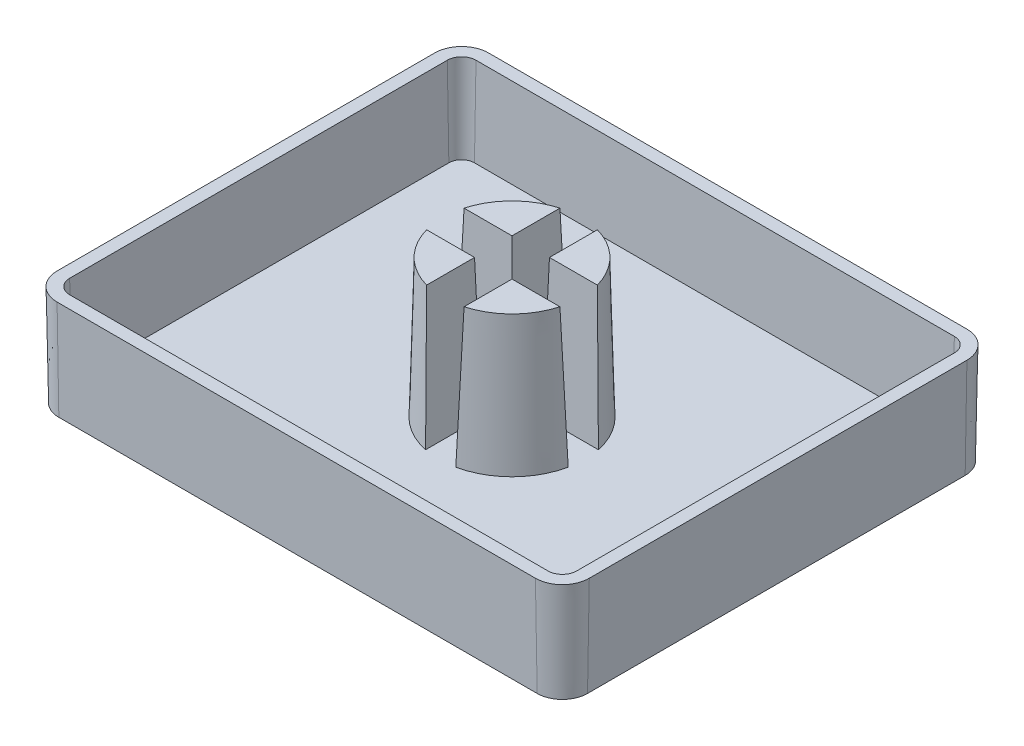
from build123d import *

# Parameters (mm, degrees)
BOSS_EXTRUDE1_DEPTH           = 4
BOSS_EXTRUDE1_DRAFT           = -1
SHELL1_T                      = -0.5
BOSS_EXTRUDE2_DEPTH           = 5.5
BOSS_EXTRUDE2_DRAFT           = 1.5
BOSS_EXTRUDE2_PROFILE_2_DEPTH = 5.5
BOSS_EXTRUDE2_PROFILE_2_DRAFT = 1.5
BOSS_EXTRUDE2_PROFILE_3_DEPTH = 5.5
BOSS_EXTRUDE2_PROFILE_3_DRAFT = 1.5
BOSS_EXTRUDE2_PROFILE_4_DEPTH = 5.5
BOSS_EXTRUDE2_PROFILE_4_DRAFT = 1.5


with BuildPart() as part:
    # Sketch1 → Boss-Extrude1 (with draft: the straight prism first)
    with BuildSketch(Plane(origin=(0, 0, 0), x_dir=(1, 0, 0), z_dir=(0, 1, 0))):
        with BuildLine():
            Line((-9.5, -8.5), (9.5, -8.5))
            ThreePointArc((9.5, -8.5), (10.207106781, -8.207106781), (10.5, -7.5))
            Line((10.5, -7.5), (10.5, 7.5))
            ThreePointArc((10.5, 7.5), (10.207106781, 8.207106781), (9.5, 8.5))
            Line((9.5, 8.5), (-9.5, 8.5))
            ThreePointArc((-9.5, 8.5), (-10.207106781, 8.207106781), (-10.5, 7.5))
            Line((-10.5, 7.5), (-10.5, -7.5))
            ThreePointArc((-10.5, -7.5), (-10.207106781, -8.207106781), (-9.5, -8.5))
        make_face()
    extrude(amount=BOSS_EXTRUDE1_DEPTH)
    # Boss-Extrude1: the draft: its side faces are tilted about the plane it starts from
    boss_extrude1_sides = [part.faces().sort_by_distance(p)[0] for p in [
        (0, 2, 8.5),
        (10.207106781, 2, 8.207106781),
        (10.5, 2, 0),
        (10.207106781, 2, -8.207106781),
        (0, 2, -8.5),
        (-10.207106781, 2, -8.207106781),
        (-10.5, 2, 0),
        (-10.207106781, 2, 8.207106781),
    ]]
    draft(boss_extrude1_sides, Plane(origin=(0, 0, 0), x_dir=(1, 0, 0), z_dir=(0, 1, 0)), BOSS_EXTRUDE1_DRAFT)

    # Shell1
    shell1_openings = [part.faces().sort_by_distance(p)[0] for p in [
        (0, 4, 0),
    ]]
    offset(amount=SHELL1_T, openings=shell1_openings, kind=Kind.INTERSECTION)


with BuildPart() as boss_extrude2_tool:
    # Sketch2 → Boss-Extrude2 (with draft: the straight prism first)
    with BuildSketch(Plane(origin=(0, 0.5, 0), x_dir=(1, 0, 0), z_dir=(0, 1, 0))):
        with BuildLine():
            ThreePointArc((-0.6, 2.831929782), (-2.046927733, 2.046927733), (-2.831929782, 0.6))
            Line((-2.831929782, 0.6), (-0.6, 0.6))
            Line((-0.6, 0.6), (-0.6, 2.831929782))
        make_face()
    extrude(amount=BOSS_EXTRUDE2_DEPTH)
    # Boss-Extrude2: the draft: its side faces are tilted about the plane it starts from
    boss_extrude2_sides = [boss_extrude2_tool.faces().sort_by_distance(p)[0] for p in [
        (-2.046927733, 3.25, -2.046927733),
        (-1.715964891, 3.25, -0.6),
        (-0.6, 3.25, -1.715964891),
    ]]
    draft(boss_extrude2_sides, Plane(origin=(0, 0.5, 0), x_dir=(1, 0, 0), z_dir=(0, 1, 0)), BOSS_EXTRUDE2_DRAFT)


with BuildPart() as part_1:
    add(part.part)

    # Boss-Extrude2: add boss_extrude2_tool
    add(boss_extrude2_tool.part)


with BuildPart() as boss_extrude2_profile_2_tool:
    # Sketch2 → Boss-Extrude2 profile 2 (with draft: the straight prism first)
    with BuildSketch(Plane(origin=(0, 0.5, 0), x_dir=(1, 0, 0), z_dir=(0, 1, 0))):
        with BuildLine():
            ThreePointArc((-2.831929782, -0.6), (-2.046927733, -2.046927733), (-0.6, -2.831929782))
            Line((-0.6, -2.831929782), (-0.6, -0.6))
            Line((-0.6, -0.6), (-2.831929782, -0.6))
        make_face()
    extrude(amount=BOSS_EXTRUDE2_PROFILE_2_DEPTH)
    # Boss-Extrude2 profile 2: the draft: its side faces are tilted about the plane it starts from
    boss_extrude2_profile_2_sides = [boss_extrude2_profile_2_tool.faces().sort_by_distance(p)[0] for p in [
        (-2.046927733, 3.25, 2.046927733),
        (-0.6, 3.25, 1.715964891),
        (-1.715964891, 3.25, 0.6),
    ]]
    draft(boss_extrude2_profile_2_sides, Plane(origin=(0, 0.5, 0), x_dir=(1, 0, 0), z_dir=(0, 1, 0)), BOSS_EXTRUDE2_PROFILE_2_DRAFT)


with BuildPart() as part_2:
    add(part_1.part)

    # Boss-Extrude2 profile 2: add boss_extrude2_profile_2_tool
    add(boss_extrude2_profile_2_tool.part)


with BuildPart() as boss_extrude2_profile_3_tool:
    # Sketch2 → Boss-Extrude2 profile 3 (with draft: the straight prism first)
    with BuildSketch(Plane(origin=(0, 0.5, 0), x_dir=(1, 0, 0), z_dir=(0, 1, 0))):
        with BuildLine():
            Line((0.6, 2.831929782), (0.6, 0.6))
            Line((0.6, 0.6), (2.831929782, 0.6))
            ThreePointArc((2.831929782, 0.6), (2.046927733, 2.046927733), (0.6, 2.831929782))
        make_face()
    extrude(amount=BOSS_EXTRUDE2_PROFILE_3_DEPTH)
    # Boss-Extrude2 profile 3: the draft: its side faces are tilted about the plane it starts from
    boss_extrude2_profile_3_sides = [boss_extrude2_profile_3_tool.faces().sort_by_distance(p)[0] for p in [
        (0.6, 3.25, -1.715964891),
        (1.715964891, 3.25, -0.6),
        (2.046927733, 3.25, -2.046927733),
    ]]
    draft(boss_extrude2_profile_3_sides, Plane(origin=(0, 0.5, 0), x_dir=(1, 0, 0), z_dir=(0, 1, 0)), BOSS_EXTRUDE2_PROFILE_3_DRAFT)


with BuildPart() as part_3:
    add(part_2.part)

    # Boss-Extrude2 profile 3: add boss_extrude2_profile_3_tool
    add(boss_extrude2_profile_3_tool.part)


with BuildPart() as boss_extrude2_profile_4_tool:
    # Sketch2 → Boss-Extrude2 profile 4 (with draft: the straight prism first)
    with BuildSketch(Plane(origin=(0, 0.5, 0), x_dir=(1, 0, 0), z_dir=(0, 1, 0))):
        with BuildLine():
            Line((0.6, -0.6), (0.6, -2.831929782))
            ThreePointArc((0.6, -2.831929782), (2.046927733, -2.046927733), (2.831929782, -0.6))
            Line((2.831929782, -0.6), (0.6, -0.6))
        make_face()
    extrude(amount=BOSS_EXTRUDE2_PROFILE_4_DEPTH)
    # Boss-Extrude2 profile 4: the draft: its side faces are tilted about the plane it starts from
    boss_extrude2_profile_4_sides = [boss_extrude2_profile_4_tool.faces().sort_by_distance(p)[0] for p in [
        (1.715964891, 3.25, 0.6),
        (0.6, 3.25, 1.715964891),
        (2.046927733, 3.25, 2.046927733),
    ]]
    draft(boss_extrude2_profile_4_sides, Plane(origin=(0, 0.5, 0), x_dir=(1, 0, 0), z_dir=(0, 1, 0)), BOSS_EXTRUDE2_PROFILE_4_DRAFT)


with BuildPart() as part_4:
    add(part_3.part)

    # Boss-Extrude2 profile 4: add boss_extrude2_profile_4_tool
    add(boss_extrude2_profile_4_tool.part)


solid = part_4.part
